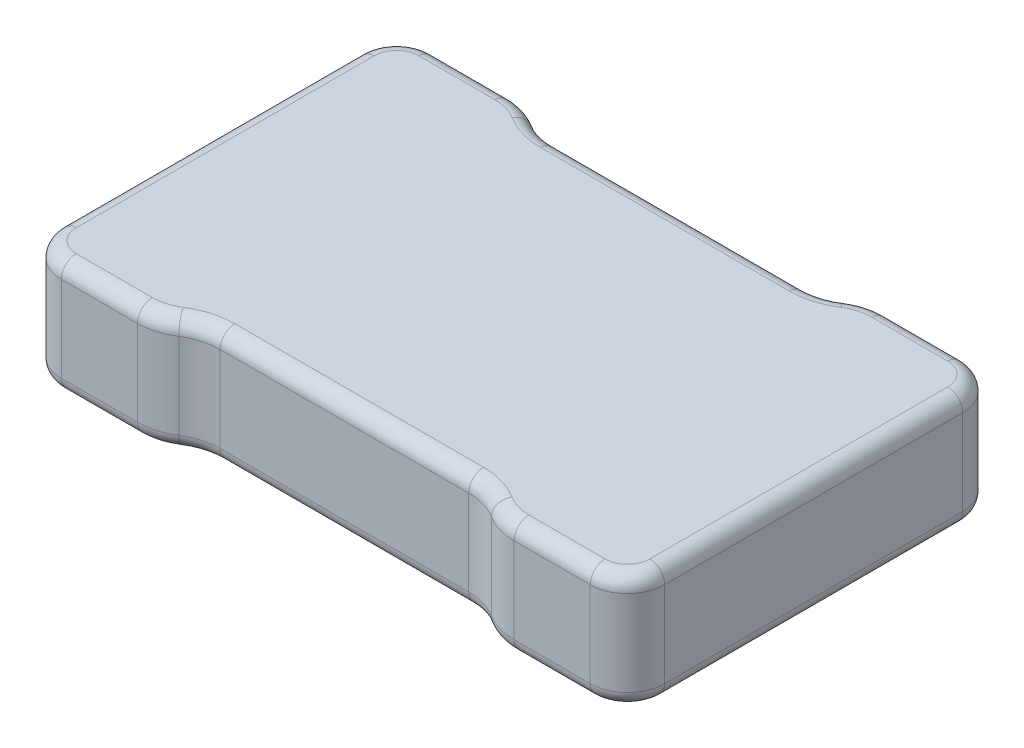
from build123d import *

# Parameters (mm, degrees)
SKETCH1_W           = 81
SKETCH1_H           = 50
BOSS_EXTRUDE1_DEPTH = 15.5
SKETCH2_W           = 45
SKETCH2_H           = 2.5
CUT_EXTRUDE1_DEPTH  = 51.054969783
FILLET1_R           = 8
FILLET2_R           = 8
FILLET3_R           = 5
FILLET4_R           = 2


with BuildPart() as part:
    # Sketch1 → Boss-Extrude1 (new body)
    with BuildSketch(Plane(origin=(0, 0, 0), x_dir=(1, 0, 0), z_dir=(0, 1, 0))):
        Rectangle(SKETCH1_W, SKETCH1_H)
    extrude(amount=BOSS_EXTRUDE1_DEPTH)

    # Sketch2 → Cut-Extrude1 (cut, through all)
    with BuildSketch(Plane(origin=(0, 15.5, 0), x_dir=(1, 0, 0), z_dir=(0, 1, 0))):
        with Locations((0, 23.75)):
            Rectangle(SKETCH2_W, SKETCH2_H)
        with Locations((0, -23.75)):
            Rectangle(SKETCH2_W, SKETCH2_H)
    extrude(amount=-CUT_EXTRUDE1_DEPTH, mode=Mode.SUBTRACT)

    # Fillet1
    # the kernel refuses this fillet: 8 mm, written as the material it adds along each edge
    with BuildSketch(Plane(origin=(22.5, 15.5, 22.5), x_dir=(-1, 0, 0), z_dir=(0, -1, 0))) as fillet1_piece_1:
        with BuildLine():
            CenterArc((5.809475019, -8), FILLET1_R, 90, 46.567463442)
            Line((0, -2.5), (-0.1161895, -2.39))
            ThreePointArc((-0.1161895, -2.39), (-0.16, -1.25), (-0.16, 0))
            Line((-0.16, 0), (0, 0.16))
            Line((0, 0.16), (5.809475019, 0.16))
            Line((5.809475019, 0.16), (5.809475019, 0))
        make_face()
    extrude(amount=15.5)
    with BuildSketch(Plane(origin=(-22.5, 15.5, 22.5), x_dir=(0, 0, 1), z_dir=(0, -1, 0)), Plane(origin=(22.5, 15.5, -22.5), x_dir=(0, 0, -1), z_dir=(0, -1, 0))) as fillet1_piece_2:
        with BuildLine():
            CenterArc((8, -5.809475019), FILLET1_R, 133.432536558, 46.567463442)
            Line((0, -5.809475019), (-0.16, -5.809475019))
            Line((-0.16, -5.809475019), (-0.16, 0))
            Line((-0.16, 0), (0, 0.16))
            ThreePointArc((0, 0.16), (1.25, 0.16), (2.39, 0.1161895))
            Line((2.39, 0.1161895), (2.5, 0))
        make_face()
    extrude(amount=15.5)
    with BuildSketch(Plane(origin=(-22.5, 15.5, -22.5), x_dir=(0, 0, -1), z_dir=(0, -1, 0))) as fillet1_piece_3:
        with BuildLine():
            CenterArc((8, 5.809475019), FILLET1_R, 180, 46.567463442)
            Line((0, 5.809475019), (-0.16, 5.809475019))
            Line((-0.16, 5.809475019), (-0.16, 0))
            Line((-0.16, 0), (0, -0.16))
            ThreePointArc((0, -0.16), (1.25, -0.16), (2.39, -0.1161895))
            Line((2.39, -0.1161895), (2.5, 0))
        make_face()
    extrude(amount=15.5)

    # Fillet2
    fillet2_edges = [part.edges().sort_by_distance(p)[0] for p in [
        (22.5, 7.75, -25),
        (-22.5, 7.75, -25),
        (22.5, 7.75, 25),
        (-22.5, 7.75, 25),
    ]]
    fillet(fillet2_edges, radius=FILLET2_R)

    # Fillet3
    fillet3_edges = [part.edges().sort_by_distance(p)[0] for p in [
        (-40.5, 7.75, -25),
        (40.5, 7.75, -25),
        (40.5, 7.75, 25),
        (-40.5, 7.75, 25),
    ]]
    fillet(fillet3_edges, radius=FILLET3_R)

    # Fillet4
    fillet4_edges = [part.edges().sort_by_distance(p)[0] for p in [
        (0, 15.5, 22.5),
        (0, 0, 22.5),
        (0, 15.5, -22.5),
        (0, 0, -22.5),
        (18.926592958, 15.5, 22.818854252),
        (-18.926592958, 0, 22.818854252),
        (-18.926592958, 15.5, -22.818854252),
        (18.926592958, 0, -22.818854252),
        (-18.926592958, 15.5, 22.818854252),
        (30.3891535, 15.5, 25),
        (18.926592958, 15.5, -22.818854252),
        (-30.3891535, 15.5, -25),
        (23.042239022, 15.5, 24.681145748),
        (-23.042239022, 15.5, 24.681145748),
        (-23.042239022, 15.5, -24.681145748),
        (23.042239022, 15.5, -24.681145748),
        (30.3891535, 0, 25),
        (18.926592958, 0, 22.818854252),
        (-30.3891535, 0, -25),
        (-18.926592958, 0, -22.818854252),
        (23.042239022, 0, 24.681145748),
        (-23.042239022, 0, 24.681145748),
        (-23.042239022, 0, -24.681145748),
        (23.042239022, 0, -24.681145748),
        (30.3891535, 0, -25),
        (30.3891535, 15.5, -25),
        (40.5, 0, 0),
        (-30.3891535, 0, 25),
        (-40.5, 0, 0),
        (-39.035533906, 0, -23.535533906),
        (-39.035533906, 0, 23.535533906),
        (39.035533906, 0, 23.535533906),
        (39.035533906, 0, -23.535533906),
        (40.5, 15.5, 0),
        (-40.5, 15.5, 0),
        (-30.3891535, 15.5, 25),
        (-39.035533906, 15.5, -23.535533906),
        (-39.035533906, 15.5, 23.535533906),
        (39.035533906, 15.5, 23.535533906),
        (39.035533906, 15.5, -23.535533906),
    ]]
    fillet(fillet4_edges, radius=FILLET4_R)


solid = part.part
